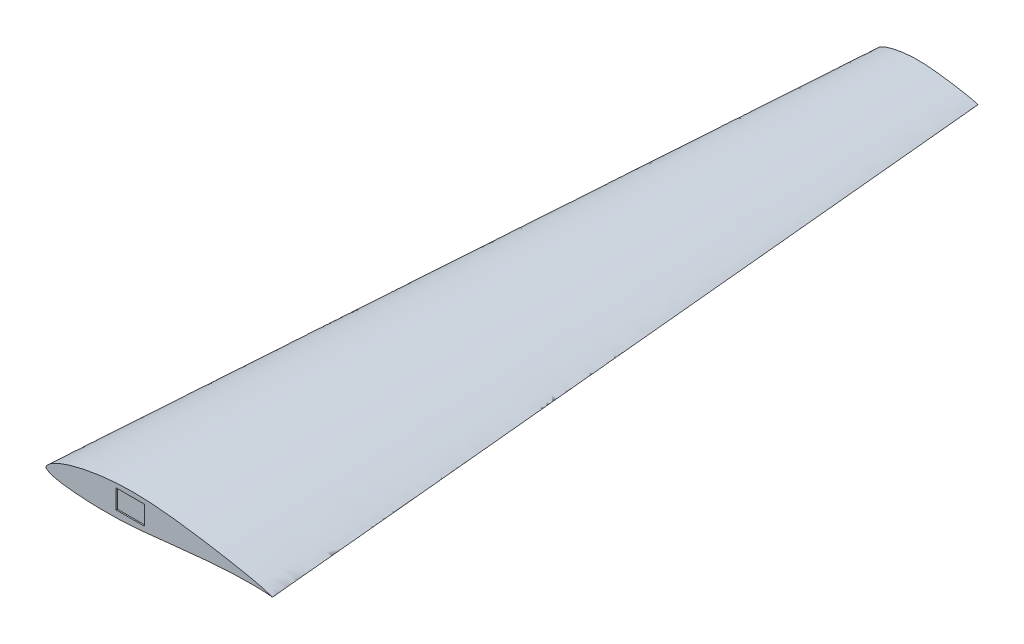
from build123d import *

# Parameters (mm, degrees)
SKETCH7_W           = 226.371566509
SKETCH7_H           = 151.802109306
BOSS_EXTRUDE1_DEPTH = 10
SKETCH9_W           = 2106.903416866
SKETCH9_H           = 613.141814674
CUT_EXTRUDE1_DEPTH  = 6969
SKETCH10_W          = 226.371566509
SKETCH10_H          = 151.802109306
CUT_EXTRUDE2_DEPTH  = 30


with BuildPart() as part:
    # Loft5: read off the stored shape, not the designer's step
    # Loft5: loft between two sections, ruled curve by curve
    loft5_from = [
        Edge.make_bspline([(-1162.904300009, -36.010271297, 0), (-1162.920517006, -36.204727761, 0), (-1162.958285904, -36.83330098, 0), (-1162.939504228, -37.728420673, 0), (-1162.758066469, -38.839996669, 0), (-1162.437156177, -39.758459861, 0), (-1161.926466184, -40.789168347, 0), (-1161.11663317, -42.102999913, 0), (-1160.040831731, -43.426132347, 0), (-1158.083169263, -45.541040295, 0), (-1156.230194309, -47.197487119, 0), (-1151.947137497, -50.590883757, 0), (-1148.313917837, -52.891126765, 0), (-1139.615268468, -57.713401364, 0), (-1133.224469615, -60.497679762, 0), (-1117.506605307, -66.507052185, 0), (-1106.79674918, -69.719281906, 0), (-1083.772537747, -75.697492401, 0), (-1070.147982922, -78.56872391, 0), (-1041.379274586, -83.838822216, 0), (-1024.931310699, -86.319425873, 0), (-990.692971942, -90.864457146, 0), (-971.603180748, -93.003387014, 0), (-932.324743639, -96.831827235, 0), (-910.836949285, -98.57655303, 0), (-867.03305602, -101.588733601, 0), (-843.417892861, -102.891593828, 0), (-795.646920767, -104.990564101, 0), (-770.191990263, -105.801112323, 0), (-719.053076037, -106.820965663, 0), (-692.070077807, -107.018325104, 0), (-638.089774283, -106.682418977, 0), (-609.794232769, -106.104249086, 0), (-553.350969113, -104.149119241, 0), (-523.906737864, -102.692951447, 0), (-465.269139857, -98.941505818, 0), (-434.781940137, -96.532158064, 0), (-374.054372749, -91.026795514, 0), (-342.522869997, -87.790684075, 0), (-279.873455726, -81.110104571, 0), (-247.464881019, -77.522247978, 0), (-183.486970195, -70.417913792, 0), (-150.626853079, -66.759083688, 0), (-86.201694341, -59.754235319, 0), (-53.345595565, -56.268462655, 0), (10.584682404, -49.761290492, 0), (42.950412474, -46.605003831, 0), (105.396969886, -40.927535562, 0), (136.769888646, -38.2760967, 0), (196.709894193, -33.685951703, 0), (226.569789575, -31.624724678, 0), (282.968833425, -28.238142766, 0), (310.802717243, -26.800443348, 0), (362.69475755, -24.694580941, 0), (388.045353539, -23.920608722, 0), (434.408953615, -23.019257081, 0), (456.730129024, -22.805971179, 0), (496.927894664, -23.002108203, 0), (516.060151014, -23.3253515, 0), (548.621162877, -24.187245718, 0), (563.505640748, -24.708525161, 0), (589.809000037, -26.332130571, 0), (601.996348163, -27.285401619, 0), (616.720254095, -28.276633639, 0), (622.242609223, -28.657087243, 0), (634.304255827, -30.519590137, 0), (637.767352205, -31.054355071, 0), (636.531359391, -30.485560222, 0), (632.598653888, -29.439590789, 0), (622.527298587, -26.560558642, 0), (617.919324193, -24.735780473, 0), (605.456552962, -20.152383052, 0), (595.564232462, -16.797599667, 0), (575.158949053, -10.257713147, 0), (563.585645313, -6.854092115, 0), (538.447932921, -0.128975114, 0), (523.522197451, 3.404598666, 0), (492.185268142, 10.516946682, 0), (474.516835379, 14.321637568, 0), (437.777607592, 21.99595553, 0), (417.423060215, 26.098780404, 0), (375.669090055, 34.314799084, 0), (352.992529576, 38.656195411, 0), (306.890358802, 47.283169543, 0), (282.184783564, 51.790498544, 0), (232.364695015, 60.680736685, 0), (205.969420458, 65.278165566, 0), (153.127527158, 74.226782037, 0), (125.398401007, 78.782215442, 0), (70.229214351, 87.555329183, 0), (41.505020999, 91.966511487, 0), (-15.287218447, 100.31694012, 0), (-44.641223467, 104.436946687, 0), (-102.361433622, 112.063594938, 0), (-132.015598337, 115.73582676, 0), (-189.996150467, 122.349479497, 0), (-219.612607884, 125.438767403, 0), (-277.210978204, 130.71516103, 0), (-306.485112567, 133.029035132, 0), (-363.18831297, 136.536762427, 0), (-391.911975766, 137.830631343, 0), (-447.376355624, 139.265879129, 0), (-475.414229911, 139.466899337, 0), (-529.3841213, 138.699551849, 0), (-556.614697566, 137.745994937, 0), (-608.881245275, 134.778356997, 0), (-635.215542093, 132.727142384, 0), (-685.532147177, 127.81492211, 0), (-710.810406809, 124.865157822, 0), (-758.764990157, 118.378962244, 0), (-782.733574385, 114.71028862, 0), (-827.816748447, 106.888055313, 0), (-850.219846889, 102.5666909, 0), (-891.958163011, 93.612393307, 0), (-912.576165162, 88.770155099, 0), (-950.535502968, 78.914803457, 0), (-969.153214753, 73.653090142, 0), (-1002.933901237, 63.107755101, 0), (-1019.365257137, 57.533207681, 0), (-1048.593877169, 46.536988765, 0), (-1062.649934572, 40.778274946, 0), (-1087.016019689, 29.529598441, 0), (-1098.573122767, 23.655031878, 0), (-1117.845408678, 12.374847986, 0), (-1126.79574539, 6.517259984, 0), (-1140.894965262, -4.460954103, 0), (-1147.2332913, -10.121614706, 0), (-1153.07844749, -16.951657421, 0), (-1154.245922458, -18.389832202, 0), (-1156.967788293, -21.962221407, 0), (-1159.10086606, -25.291265921, 0), (-1161.256385882, -29.791293488, 0), (-1162.09993706, -31.987755387, 0), (-1162.700367537, -34.418990668, 0), (-1162.855648208, -35.42689219, 0), (-1162.904300009, -36.010271297, 0)], [0, 0, 0, 0, 0.000158858, 0.000512164, 0.000723803, 0.00107711, 0.001302238, 0.001655545, 0.002333877, 0.002687183, 0.00400362, 0.004356926, 0.007144152, 0.007497458, 0.012464278, 0.012817584, 0.021220552, 0.021573858, 0.032223796, 0.032577102, 0.045442075, 0.045795381, 0.060764694, 0.061118, 0.078005039, 0.078358345, 0.096953849, 0.097307155, 0.117385453, 0.117738759, 0.139053693, 0.139407, 0.161796849, 0.162150155, 0.185501716, 0.185855022, 0.210106345, 0.210459652, 0.235623072, 0.235976379, 0.261883226, 0.262236532, 0.288515909, 0.288869215, 0.31512997, 0.315483276, 0.341318171, 0.341671477, 0.366662093, 0.367015399, 0.390736041, 0.391089347, 0.413133747, 0.413487053, 0.433466039, 0.433819346, 0.451372334, 0.45172564, 0.466514145, 0.466867452, 0.478637876, 0.478991182, 0.487516787, 0.487870093, 0.492959922, 0.493313228, 0.49479887, 0.495152176, 0.496579124, 0.496932431, 0.501575489, 0.501928795, 0.509106502, 0.509459808, 0.518845117, 0.519198423, 0.530915273, 0.53126858, 0.545345843, 0.545699149, 0.561928754, 0.56228206, 0.580423299, 0.580776605, 0.600566162, 0.600919468, 0.622080968, 0.622434275, 0.644662984, 0.64501629, 0.66802863, 0.668381936, 0.691867948, 0.692221254, 0.715901904, 0.71625521, 0.739850827, 0.740204134, 0.76346205, 0.763815356, 0.786571668, 0.786924974, 0.809097378, 0.809450685, 0.830976381, 0.831329688, 0.852176229, 0.852529536, 0.872590541, 0.872943847, 0.892023758, 0.892377064, 0.910288183, 0.910641489, 0.927216198, 0.927569504, 0.942648105, 0.943001411, 0.956449628, 0.956802934, 0.968485862, 0.968839169, 0.978697266, 0.979050572, 0.987061378, 0.987414684, 0.993595691, 0.993948997, 0.994753897, 0.995107204, 0.997609477, 0.997962784, 0.999170113, 0.999523419, 1, 1, 1, 1], 3),
    ]
    loft5_to = [
        Edge.make_bspline([(-751.127407138, -47.646450923, 6200), (-751.141425132, -47.731701038, 6200), (-751.181479745, -48.007349219, 6200), (-751.212003011, -48.400212637, 6200), (-751.205936582, -48.902236553, 6200), (-751.149350948, -49.329465992, 6200), (-750.994737817, -49.811820136, 6200), (-750.69310225, -50.431282994, 6200), (-750.256246487, -51.045969648, 6200), (-749.416488377, -52.010755452, 6200), (-748.611427802, -52.761584437, 6200), (-746.73086348, -54.287926497, 6200), (-745.127778881, -55.315521698, 6200), (-741.271616254, -57.451893168, 6200), (-738.436071417, -58.674361062, 6200), (-731.452005928, -61.28610243, 6200), (-726.694952759, -62.667060725, 6200), (-716.466679165, -65.209751508, 6200), (-710.416790484, -66.415088778, 6200), (-697.644342596, -68.600756178, 6200), (-690.344479221, -69.611682633, 6200), (-675.151371616, -71.436270257, 6200), (-666.682488131, -72.277308383, 6200), (-649.260178746, -73.751704674, 6200), (-639.731015486, -74.402627498, 6200), (-620.308326956, -75.486802895, 6200), (-609.839170905, -75.928604398, 6200), (-588.664210242, -76.583675373, 6200), (-577.382832209, -76.796294591, 6200), (-554.722067026, -76.953786876, 6200), (-542.767268644, -76.886108019, 6200), (-518.855535363, -76.427358696, 6200), (-506.323726288, -76.008756046, 6200), (-481.330177816, -74.818526637, 6200), (-468.29453437, -74.00430387, 6200), (-442.339202583, -72.005445654, 6200), (-428.847066353, -70.762228889, 6200), (-401.976193921, -67.971675754, 6200), (-388.026457908, -66.353929852, 6200), (-360.311756195, -63.025470298, 6200), (-345.975801609, -61.244463522, 6200), (-317.675438659, -57.71760724, 6200), (-303.140030242, -55.901194166, 6200), (-274.64121352, -52.413546609, 6200), (-260.106661837, -50.672935607, 6200), (-231.824260001, -47.407455683, 6200), (-217.505056961, -45.814966276, 6200), (-189.875157788, -42.924178108, 6200), (-175.992823604, -41.560556741, 6200), (-149.466929055, -39.165391295, 6200), (-136.251337684, -38.071782211, 6200), (-111.286803427, -36.230090033, 6200), (-98.965105274, -35.424161848, 6200), (-75.989967226, -34.175170143, 6200), (-64.764072704, -33.677660304, 6200), (-44.229229766, -32.995122157, 6200), (-34.343056361, -32.763382861, 6200), (-16.538258232, -32.601555003, 6200), (-8.05769346, -32.626935881, 6200), (6.385837086, -32.809037312, 6200), (12.97290427, -32.944349073, 6200), (24.591679793, -33.488374438, 6200), (30.030060425, -33.838730721, 6200), (36.68993115, -34.204579094, 6200), (39.034036697, -34.311166181, 6200), (44.073344639, -34.987900882, 6200), (45.927247352, -35.265215584, 6200), (46.468035896, -35.238418769, 6200), (45.024469602, -34.862364293, 6200), (40.234120624, -33.603433343, 6200), (38.07946271, -32.80994025, 6200), (32.655380595, -30.878800399, 6200), (28.285312988, -29.453284575, 6200), (19.172424622, -26.650341903, 6200), (14.018896651, -25.199296771, 6200), (2.859749783, -22.352634015, 6200), (-3.76900719, -20.869046961, 6200), (-17.695751063, -17.895906333, 6200), (-25.54564439, -16.31180281, 6200), (-41.864822426, -13.125457918, 6200), (-50.905693723, -11.426531929, 6200), (-69.451327564, -8.030998734, 6200), (-79.522670229, -6.240572572, 6200), (-99.996716228, -2.689257219, 6200), (-110.967871892, -0.837558428, 6200), (-133.090718616, 2.80806841, 6200), (-144.810978199, 4.689733268, 6200), (-168.272744519, 8.34388716, 6200), (-180.583631154, 10.199264824, 6200), (-205.075357182, 13.762168612, 6200), (-217.826185503, 15.548053992, 6200), (-243.034336985, 18.91501172, 6200), (-256.06240455, 20.56872842, 6200), (-281.677276649, 23.610796864, 6200), (-294.835635649, 25.064984745, 6200), (-320.559817263, 27.657899897, 6200), (-333.698000986, 28.854926004, 6200), (-359.244905506, 30.859896083, 6200), (-372.226857308, 31.716874049, 6200), (-397.366811805, 32.947010661, 6200), (-410.098991872, 33.356641239, 6200), (-434.678287394, 33.677542349, 6200), (-447.100446372, 33.607926016, 6200), (-471.005220483, 32.96359131, 6200), (-483.063233533, 32.387754572, 6200), (-506.20108055, 30.778982811, 6200), (-517.855832223, 29.721818889, 6200), (-540.118788289, 27.261468573, 6200), (-551.300593789, 25.811809028, 6200), (-572.508172184, 22.667090059, 6200), (-583.105791709, 20.906726386, 6200), (-603.034084244, 17.188201501, 6200), (-612.934669547, 15.148363328, 6200), (-631.375133313, 10.948584903, 6200), (-640.48228119, 8.689126763, 6200), (-657.244351257, 4.114131131, 6200), (-665.463564111, 1.681731434, 6200), (-680.37191932, -3.171909182, 6200), (-687.621764667, -5.728454315, 6200), (-700.513224708, -10.751709364, 6200), (-706.711546364, -13.373193996, 6200), (-717.45173122, -18.47336174, 6200), (-722.545778818, -21.12763347, 6200), (-731.03727156, -26.204324501, 6200), (-734.982039139, -28.830667966, 6200), (-741.194715598, -33.73310934, 6200), (-743.997220988, -36.25019478, 6200), (-746.590147531, -39.272983414, 6200), (-747.109292328, -39.908239355, 6200), (-748.322705006, -41.483173753, 6200), (-749.284306226, -42.948163639, 6200), (-750.272684648, -44.924056037, 6200), (-750.675662256, -45.886522389, 6200), (-750.987134729, -46.949220976, 6200), (-751.085352453, -47.390696319, 6200), (-751.127407138, -47.646450923, 6200)], [0, 0, 0, 0, 0.000158858, 0.000512164, 0.000723803, 0.00107711, 0.001302238, 0.001655545, 0.002333877, 0.002687183, 0.00400362, 0.004356926, 0.007144152, 0.007497458, 0.012464278, 0.012817584, 0.021220552, 0.021573858, 0.032223796, 0.032577102, 0.045442075, 0.045795381, 0.060764694, 0.061118, 0.078005039, 0.078358345, 0.096953849, 0.097307155, 0.117385453, 0.117738759, 0.139053693, 0.139407, 0.161796849, 0.162150155, 0.185501716, 0.185855022, 0.210106345, 0.210459652, 0.235623072, 0.235976379, 0.261883226, 0.262236532, 0.288515909, 0.288869215, 0.31512997, 0.315483276, 0.341318171, 0.341671477, 0.366662093, 0.367015399, 0.390736041, 0.391089347, 0.413133747, 0.413487053, 0.433466039, 0.433819346, 0.451372334, 0.45172564, 0.466514145, 0.466867452, 0.478637876, 0.478991182, 0.487516787, 0.487870093, 0.492959922, 0.493313228, 0.49479887, 0.495152176, 0.496579124, 0.496932431, 0.501575489, 0.501928795, 0.509106502, 0.509459808, 0.518845117, 0.519198423, 0.530915273, 0.53126858, 0.545345843, 0.545699149, 0.561928754, 0.56228206, 0.580423299, 0.580776605, 0.600566162, 0.600919468, 0.622080968, 0.622434275, 0.644662984, 0.64501629, 0.66802863, 0.668381936, 0.691867948, 0.692221254, 0.715901904, 0.71625521, 0.739850827, 0.740204134, 0.76346205, 0.763815356, 0.786571668, 0.786924974, 0.809097378, 0.809450685, 0.830976381, 0.831329688, 0.852176229, 0.852529536, 0.872590541, 0.872943847, 0.892023758, 0.892377064, 0.910288183, 0.910641489, 0.927216198, 0.927569504, 0.942648105, 0.943001411, 0.956449628, 0.956802934, 0.968485862, 0.968839169, 0.978697266, 0.979050572, 0.987061378, 0.987414684, 0.993595691, 0.993948997, 0.994753897, 0.995107204, 0.997609477, 0.997962784, 0.999170113, 0.999523419, 1, 1, 1, 1], 3),
    ]
    loft5 = Solid(Shell([*[Face.make_surface_from_curves(loft5_from[k], loft5_to[k]) for k in range(1)], Face(Wire(loft5_from)), Face(Wire(loft5_to))]))
    add(loft5)

    # Sketch7 → Boss-Extrude1 (add)
    with BuildSketch(Plane(origin=(0, 0, 0), x_dir=(-1, 0, 0), z_dir=(0, 0, -1))):
        with Locations((491.847907021, 24.970484801)):
            Rectangle(SKETCH7_W, SKETCH7_H)
    extrude(amount=BOSS_EXTRUDE1_DEPTH)

    # Mirror1: part across plane


with BuildPart() as part_1:
    add(part.part)
    add(part.part.mirror(Plane(origin=(0, 0, -10), x_dir=(1, 0, 0), z_dir=(0, 0, -1))))

    # Sketch9 → Cut-Extrude1 (cut)
    with BuildSketch(Plane(origin=(0, 0, 0), x_dir=(-1, 0, 0), z_dir=(0, 0, -1))):
        with Locations((238.179961491, 57.335636537)):
            Rectangle(SKETCH9_W, SKETCH9_H)
    extrude(amount=-CUT_EXTRUDE1_DEPTH, mode=Mode.SUBTRACT)

    # Sketch10 → Cut-Extrude2 (cut)
    with BuildSketch(Plane.XY):
        with Locations((-491.847907021, 24.970484801)):
            Rectangle(SKETCH10_W, SKETCH10_H)
    extrude(amount=-CUT_EXTRUDE2_DEPTH, mode=Mode.SUBTRACT)


solid = part_1.part
